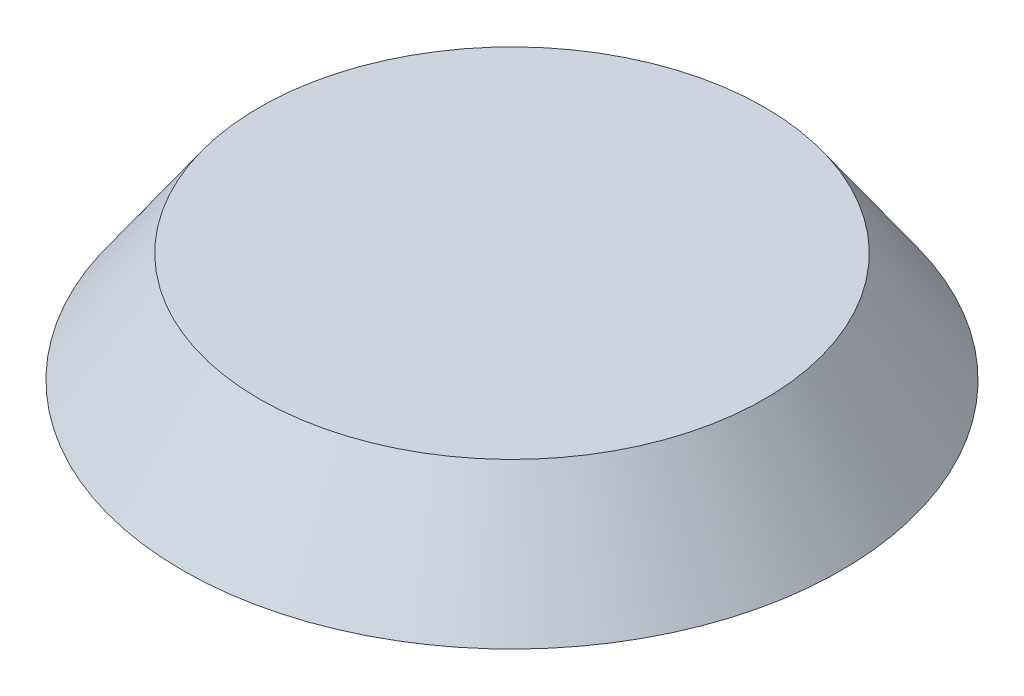
from build123d import *

# Parameters (mm, degrees)
ESQUISSE1_R                                 = 30
BOSS_EXTRU_1_DEPTH                          = 10
CHANFREIN1_SIZE                             = 10
CHANFREIN1_SIZE_2                           = 7.002075382
COQUE2_T                                    = -1.5
ESQUISSE2_R                                 = 4
BOSS_EXTRU_2_DEPTH                          = 8.5
CHANFREIN2_SIZE                             = 8.5
CHANFREIN2_SIZE_2                           = 0.445466124
ESQUISSE5_R                                 = 2.554533876
ENL_V_MAT_EXTRU_1_DEPTH                     = 8.5
R_P_TITION_CIRCULAIRE1_COUNT                = 3
CHANFREIN2_OF_R_P_TITION_CIRCULAIRE1_SIZE   = 8.5
CHANFREIN2_OF_R_P_TITION_CIRCULAIRE1_SIZE_2 = 0.445466124


with BuildPart() as part:
    # Esquisse1 → Boss.-Extru.1 (new body)
    with BuildSketch(Plane(origin=(0, 0, 0), x_dir=(1, 0, 0), z_dir=(0, 1, 0))):
        with Locations(Location((0, 0, 0), (0, 0, 270))):
            Circle(ESQUISSE1_R)
    extrude(amount=BOSS_EXTRU_1_DEPTH)

    # Chanfrein1
    # the kernel refuses this chamfer: 10, 7.002075382 mm, written as the material it takes off along each edge
    with BuildSketch(Plane(origin=(0, 10, 0), x_dir=(0, 0, 1), z_dir=(-1, 0, 0))) as chanfrein1_piece_1:
        Polygon((30, -CHANFREIN1_SIZE), (30 - CHANFREIN1_SIZE_2, 0), (30, 0), align=None)
    revolve(axis=Axis((0, 10, 0), (0, 1, 0)), mode=Mode.SUBTRACT)

    # Coque2
    coque2_openings = [part.faces().sort_by_distance(p)[0] for p in [
        (0, 0, 0),
    ]]
    offset(amount=COQUE2_T, openings=coque2_openings, kind=Kind.INTERSECTION)

    # Esquisse2 → Boss.-Extru.2 (add)
    with BuildSketch(Plane.XZ.offset(-8.5)):
        with Locations(Location((-16, 0, 0), (0, 0, 90))):
            Circle(ESQUISSE2_R)
    boss_extru_2 = extrude(amount=BOSS_EXTRU_2_DEPTH)

    # Chanfrein2
    # the kernel refuses this chamfer: 8.5, 0.445466124 mm, written as the material it takes off along each edge
    with BuildSketch(Plane(origin=(-16, 0, 0), x_dir=(0, 0, 1), z_dir=(1, 0, 0))) as chanfrein2_piece_1_section:
        Polygon((4, -CHANFREIN2_SIZE), (4 - CHANFREIN2_SIZE_2, 0), (4, 0), align=None)
    chanfrein2_piece_1 = revolve(axis=Axis((-16, 0, 0), (0, -1, 0)), mode=Mode.PRIVATE)
    chanfrein2_piece_1 = split(chanfrein2_piece_1, bisect_by=Plane(origin=(-16, 8.5, -3.812448858), z_dir=(0, -1, 0)), keep=Keep.TOP, mode=Mode.PRIVATE)
    add(chanfrein2_piece_1, mode=Mode.SUBTRACT)

    # Esquisse5 → Enlèv. mat.-Extru.1 (cut)
    with BuildSketch(Plane.XZ):
        with Locations(Location((-16, 0, 0), (0, 0, 270))):
            Circle(ESQUISSE5_R)
    enl_v_mat_extru_1 = extrude(amount=-ENL_V_MAT_EXTRU_1_DEPTH, mode=Mode.SUBTRACT)

    # Répétition circulaire1: Boss.-Extru.2, Enlèv. mat.-Extru.1 ×3 about axis
    r_p_tition_circulaire1_axis = Axis((0, 0, 0), (0, 1, 0))
    add([boss_extru_2.rotate(r_p_tition_circulaire1_axis, i * 360 / R_P_TITION_CIRCULAIRE1_COUNT) for i in range(1, R_P_TITION_CIRCULAIRE1_COUNT)])
    add([enl_v_mat_extru_1.rotate(r_p_tition_circulaire1_axis, i * 360 / R_P_TITION_CIRCULAIRE1_COUNT) for i in range(1, R_P_TITION_CIRCULAIRE1_COUNT)], mode=Mode.SUBTRACT)

    # Chanfrein2 of Répétition circulaire1
    # the kernel refuses this chamfer: 8.5, 0.445466124 mm, written as the material it takes off along each edge
    with BuildSketch(Plane(origin=(8, 0, 13.856406461), x_dir=(0.8660254037844387, 0, -0.5000000000000001), z_dir=(-0.5000000000000001, 0, -0.8660254037844387))) as chanfrein2_of_r_p_tition_circulaire1_piece_1_section:
        Polygon((4, -CHANFREIN2_OF_R_P_TITION_CIRCULAIRE1_SIZE), (4 - CHANFREIN2_OF_R_P_TITION_CIRCULAIRE1_SIZE_2, 0), (4, 0), align=None)
    chanfrein2_of_r_p_tition_circulaire1_piece_1 = revolve(axis=Axis((8, 0, 13.856406461), (0, -1, 0)), mode=Mode.PRIVATE)
    chanfrein2_of_r_p_tition_circulaire1_piece_1 = split(chanfrein2_of_r_p_tition_circulaire1_piece_1, bisect_by=Plane(origin=(4.698322438, 8.5, 15.762630889), z_dir=(0, -1, 0)), keep=Keep.TOP, mode=Mode.PRIVATE)
    add(chanfrein2_of_r_p_tition_circulaire1_piece_1, mode=Mode.SUBTRACT)
    with BuildSketch(Plane(origin=(8, 0, -13.856406461), x_dir=(-0.8660254037844384, 0, -0.5000000000000003), z_dir=(-0.5000000000000003, 0, 0.8660254037844384))) as chanfrein2_of_r_p_tition_circulaire1_piece_2_section:
        Polygon((4, -CHANFREIN2_OF_R_P_TITION_CIRCULAIRE1_SIZE), (4 - CHANFREIN2_OF_R_P_TITION_CIRCULAIRE1_SIZE_2, 0), (4, 0), align=None)
    chanfrein2_of_r_p_tition_circulaire1_piece_2 = revolve(axis=Axis((8, 0, -13.856406461), (0, -1, 0)), mode=Mode.PRIVATE)
    chanfrein2_of_r_p_tition_circulaire1_piece_2 = split(chanfrein2_of_r_p_tition_circulaire1_piece_2, bisect_by=Plane(origin=(11.301677562, 8.5, -11.950182032), z_dir=(0, -1, 0)), keep=Keep.TOP, mode=Mode.PRIVATE)
    add(chanfrein2_of_r_p_tition_circulaire1_piece_2, mode=Mode.SUBTRACT)


solid = part.part
